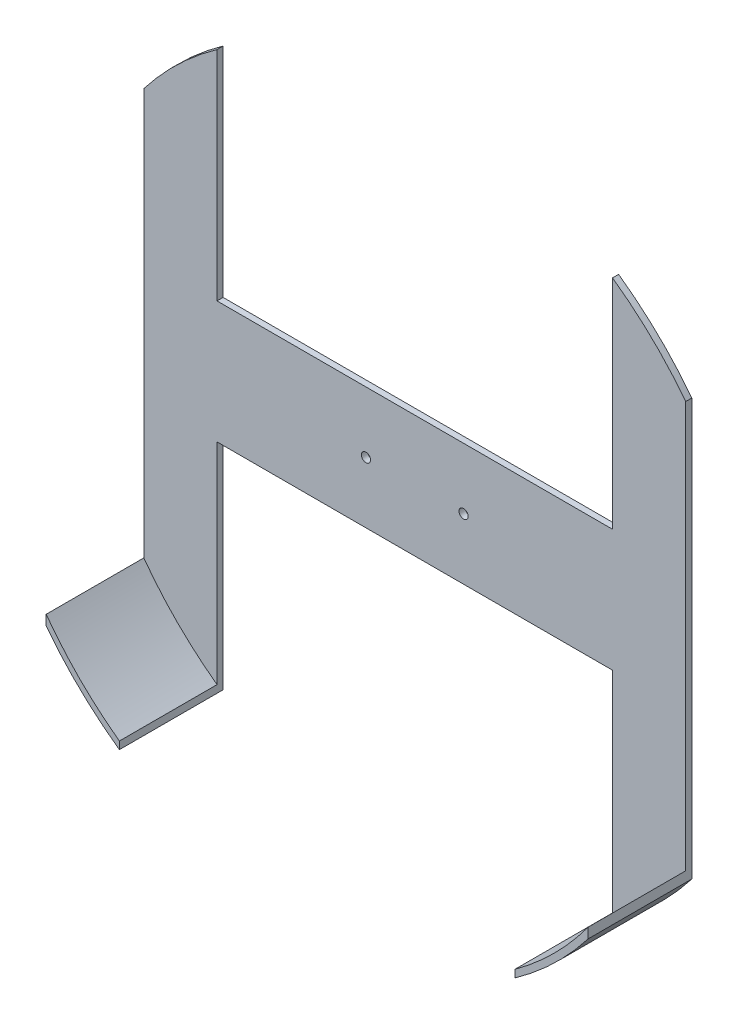
from build123d import *

# Parameters (mm, degrees)
SKETCH1_R           = 2.38125
BOSS_EXTRUDE1_DEPTH = 3.175
BOSS_EXTRUDE2_DEPTH = 50.8


with BuildPart() as part:
    # Sketch1 → Boss-Extrude1 (new body)
    with BuildSketch(Plane.XY):
        with BuildLine():
            Line((-102.865544724, 31.75), (-102.865544724, 145.022480011))
            ThreePointArc((-102.865544724, 145.022480011), (-123.286100966, 128.114703717), (-140.965544724, 108.358456987))
            Line((-140.965544724, 108.358456987), (-140.965544724, -108.358456987))
            ThreePointArc((-140.965544724, -108.358456987), (-123.286100966, -128.114703717), (-102.865544724, -145.022480011))
            Line((-102.865544724, -145.022480011), (-102.865544724, -31.75))
            Line((-102.865544724, -31.75), (102.865544724, -31.75))
            Line((102.865544724, -31.75), (102.865544724, -145.022480011))
            ThreePointArc((102.865544724, -145.022480011), (123.286100966, -128.114703717), (140.965544724, -108.358456987))
            Line((140.965544724, -108.358456987), (140.965544724, 108.358456987))
            ThreePointArc((140.965544724, 108.358456987), (123.286100966, 128.114703717), (102.865544724, 145.022480011))
            Line((102.865544724, 145.022480011), (102.865544724, 31.75))
            Line((102.865544724, 31.75), (-102.865544724, 31.75))
        make_face()
        with Locations((25.4, 0)):
            Circle(SKETCH1_R, mode=Mode.SUBTRACT)
        with Locations((-25.4, 0)):
            Circle(SKETCH1_R, mode=Mode.SUBTRACT)
    extrude(amount=BOSS_EXTRUDE1_DEPTH)

    # Sketch2 → Boss-Extrude2 (add)
    with BuildSketch(Plane.XY.offset(3.175)):
        with BuildLine():
            ThreePointArc((-102.865544724, -141.111907129), (-123.390730215, -123.566250741), (-140.965544724, -103.066026535))
            Line((-140.965544724, -103.066026535), (-140.965544724, -108.358456987))
            ThreePointArc((-140.965544724, -108.358456987), (-123.286100966, -128.114703717), (-102.865544724, -145.022480011))
            Line((-102.865544724, -145.022480011), (-102.865544724, -141.111907129))
        make_face()
        with BuildLine():
            ThreePointArc((140.965544724, -103.066026535), (123.390730215, -123.566250741), (102.865544724, -141.111907129))
            Line((102.865544724, -141.111907129), (102.865544724, -145.022480011))
            ThreePointArc((102.865544724, -145.022480011), (123.286100966, -128.114703717), (140.965544724, -108.358456987))
            Line((140.965544724, -108.358456987), (140.965544724, -103.066026535))
        make_face()
    extrude(amount=BOSS_EXTRUDE2_DEPTH)


solid = part.part
